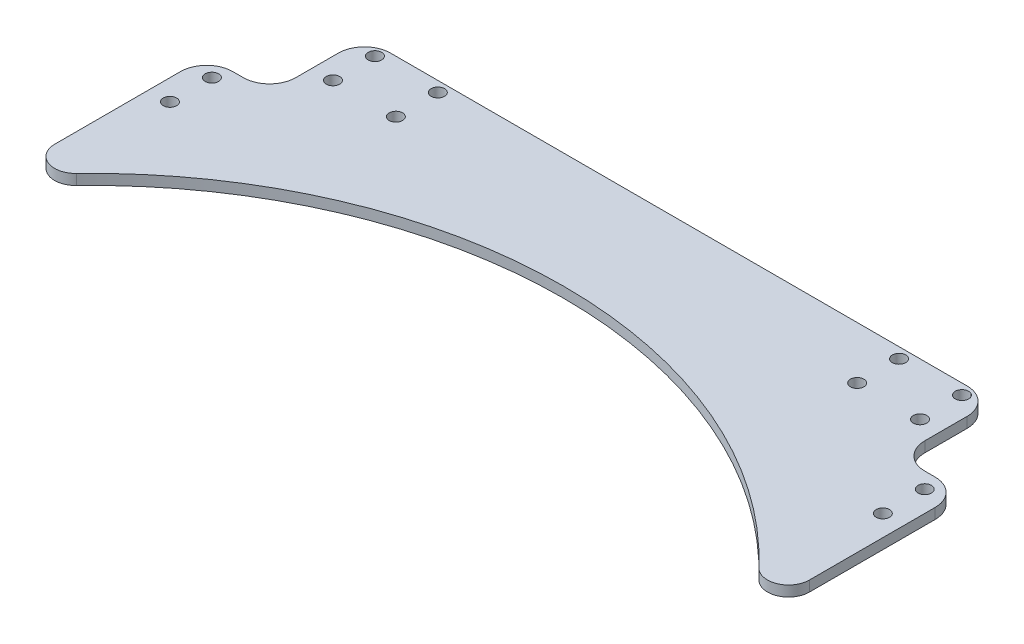
from build123d import *

# Parameters (mm, degrees)
BOSS_EXTRUDE1_DEPTH = 3.175
SKETCH3_R           = 2.032
CUT_EXTRUDE1_DEPTH  = 247.466724427
FILLET1_R           = 6.35
SKETCH4_W           = 19.05
SKETCH4_H           = 28.733872304
SKETCH4_W_2         = 19.050000004
SKETCH4_R           = 2.032
CUT_EXTRUDE2_DEPTH  = 247.466724427
FILLET2_R           = 7.9375


with BuildPart() as part:
    # Sketch1 → Boss-Extrude1 (new body)
    with BuildSketch(Plane(origin=(0, 0, 0), x_dir=(1, 0, 0), z_dir=(0, 1, 0))):
        with BuildLine():
            Line((0, 0), (0, 92.075))
            Line((0, 92.075), (228.6, 92.075))
            Line((228.6, 92.075), (228.6, 0))
            ThreePointArc((228.6, 0), (114.3, 57.15), (0, 0))
        make_face()
    extrude(amount=BOSS_EXTRUDE1_DEPTH)

    # Sketch3 → Cut-Extrude1 (cut, through all)
    with BuildSketch(Plane.XZ):
        with Locations((44.45, -76.2)):
            Circle(SKETCH3_R)
        with Locations((25.4, -76.2)):
            Circle(SKETCH3_R)
        with Locations((44.45, -88.9)):
            Circle(SKETCH3_R)
        with Locations((25.4, -88.9)):
            Circle(SKETCH3_R)
        with Locations((203.2, -76.2)):
            Circle(SKETCH3_R)
        with Locations((203.2, -88.9)):
            Circle(SKETCH3_R)
        with Locations((184.15, -88.9)):
            Circle(SKETCH3_R)
        with Locations((184.15, -76.2)):
            Circle(SKETCH3_R)
    extrude(amount=-CUT_EXTRUDE1_DEPTH, mode=Mode.SUBTRACT)

    # Fillet1
    fillet1_edges = [part.edges().sort_by_distance(p)[0] for p in [
        (0, 1.5875, 0),
        (228.6, 1.5875, 0),
    ]]
    fillet(fillet1_edges, radius=FILLET1_R)

    # Sketch4 → Cut-Extrude2 (cut, through all)
    with BuildSketch(Plane.XZ):
        with Locations((219.075, -77.708063848)):
            Rectangle(SKETCH4_W, SKETCH4_H)
        with Locations((9.525000002, -77.708063848)):
            Rectangle(SKETCH4_W_2, SKETCH4_H)
        with Locations((6.35, -45.878627696)):
            Circle(SKETCH4_R)
        with Locations((6.35, -58.578627696)):
            Circle(SKETCH4_R)
        with Locations((222.25, -45.878627696)):
            Circle(SKETCH4_R)
        with Locations((222.25, -58.578627696)):
            Circle(SKETCH4_R)
    extrude(amount=-CUT_EXTRUDE2_DEPTH, mode=Mode.SUBTRACT)

    # Fillet2
    fillet2_edges = [part.edges().sort_by_distance(p)[0] for p in [
        (209.55, 1.5875, -92.075),
        (209.55, 1.5875, -63.341127696),
        (228.6, 1.5875, -63.341127696),
        (19.050000004, 1.5875, -92.075),
        (19.050000004, 1.5875, -63.341127696),
        (0, 1.5875, -63.341127696),
    ]]
    fillet(fillet2_edges, radius=FILLET2_R)


solid = part.part
